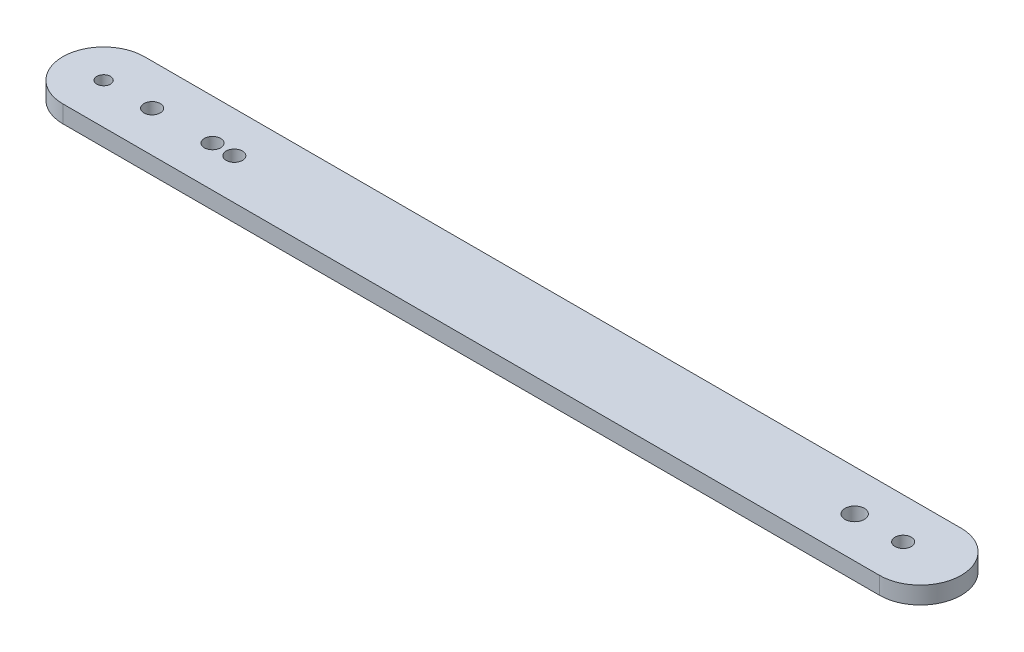
from build123d import *

# Parameters (mm, degrees)
SKETCH1_R           = 1.25
SKETCH1_R_2         = 1.5
SKETCH1_R_3         = 1.775813941
BOSS_EXTRUDE1_DEPTH = 3.175


with BuildPart() as part:
    # Sketch1 → Boss-Extrude1 (new body)
    with BuildSketch(Plane(origin=(0, 0, 0), x_dir=(1, 0, 0), z_dir=(0, 1, 0))):
        with BuildLine():
            Line((-75, 7.5), (75, 7.5))
            ThreePointArc((75, 7.5), (82.5, 0), (75, -7.5))
            Line((75, -7.5), (-75, -7.5))
            ThreePointArc((-75, -7.5), (-82.5, 0), (-75, 7.5))
        make_face()
        with Locations((-75, 0)):
            Circle(SKETCH1_R, mode=Mode.SUBTRACT)
        with Locations((-66.1, 0)):
            Circle(SKETCH1_R_2, mode=Mode.SUBTRACT)
        with Locations((-55, 0)):
            Circle(SKETCH1_R_2, mode=Mode.SUBTRACT)
        with Locations((-51, 0)):
            Circle(SKETCH1_R_2, mode=Mode.SUBTRACT)
        with Locations((71.838939652, 0)):
            Circle(SKETCH1_R_2, mode=Mode.SUBTRACT)
        with Locations((62.938939652, 0)):
            Circle(SKETCH1_R_3, mode=Mode.SUBTRACT)
    extrude(amount=BOSS_EXTRUDE1_DEPTH)


solid = part.part
